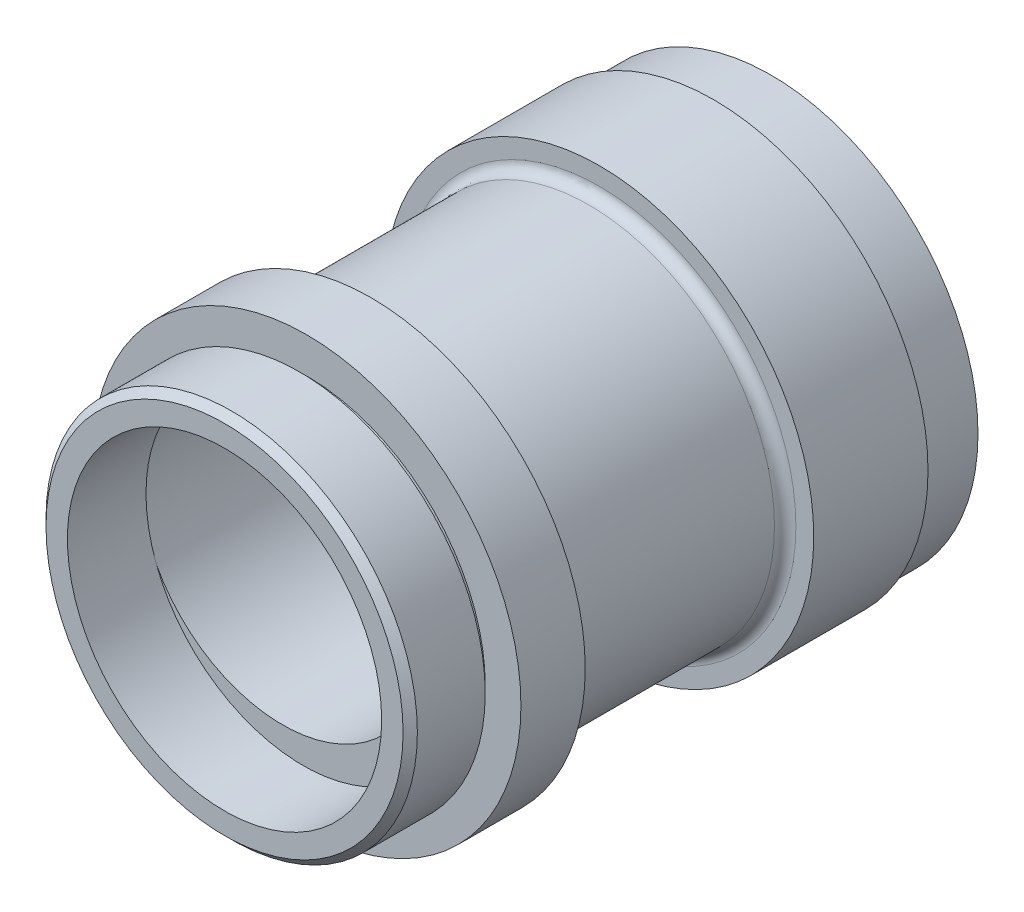
from build123d import *

# Parameters (mm, degrees)
SKETCH1_R                    = 14.5
BOSS_EXTRUDE1_DEPTH          = 4
SKETCH2_R                    = 15
BOSS_EXTRUDE2_DEPTH          = 8
SKETCH3_R                    = 13
BOSS_EXTRUDE3_DEPTH          = 16
SKETCH4_R                    = 15
BOSS_EXTRUDE4_DEPTH          = 4.5
SKETCH5_R                    = 12.5
BOSS_EXTRUDE5_DEPTH          = 0.5
SKETCH6_R                    = 13
BOSS_EXTRUDE6_DEPTH          = 5.25
SKETCH7_R                    = 11
CUT_EXTRUDE1_DEPTH           = 5.5
SKETCH8_R                    = 10
CUT_EXTRUDE2_DEPTH           = 32.75
FILLET1_R                    = 0.75
CHAMFER1_SIZE                = 0.5
F_2_0_2_DIAMETER_HOLE3_D     = 2
F_2_0_2_DIAMETER_HOLE3_DEPTH = 8.649139381
F_2_0_2_DIAMETER_HOLE3_TIP   = 0.600860619


with BuildPart() as part:
    # Sketch1 → Boss-Extrude1 (new body)
    with BuildSketch(Plane.XY):
        Circle(SKETCH1_R)
    extrude(amount=BOSS_EXTRUDE1_DEPTH)

    # Sketch2 → Boss-Extrude2 (add)
    with BuildSketch(Plane.XY.offset(4)):
        Circle(SKETCH2_R)
    extrude(amount=BOSS_EXTRUDE2_DEPTH)

    # Sketch3 → Boss-Extrude3 (add)
    with BuildSketch(Plane.XY.offset(12)):
        Circle(SKETCH3_R)
    extrude(amount=BOSS_EXTRUDE3_DEPTH)

    # Sketch4 → Boss-Extrude4 (add)
    with BuildSketch(Plane.XY.offset(28)):
        Circle(SKETCH4_R)
    extrude(amount=BOSS_EXTRUDE4_DEPTH)

    # Sketch5 → Boss-Extrude5 (add)
    with BuildSketch(Plane.XY.offset(32.5)):
        Circle(SKETCH5_R)
    extrude(amount=BOSS_EXTRUDE5_DEPTH)

    # Sketch6 → Boss-Extrude6 (add)
    with BuildSketch(Plane.XY.offset(33)):
        Circle(SKETCH6_R)
    extrude(amount=BOSS_EXTRUDE6_DEPTH)

    # Sketch7 → Cut-Extrude1 (cut)
    with BuildSketch(Plane.XY.offset(38.25)):
        Circle(SKETCH7_R)
    extrude(amount=-CUT_EXTRUDE1_DEPTH, mode=Mode.SUBTRACT)

    # Sketch8 → Cut-Extrude2 (cut)
    with BuildSketch(Plane.XY.offset(32.75)):
        with Locations((-1.44, 0.75)):
            Circle(SKETCH8_R)
    extrude(amount=-CUT_EXTRUDE2_DEPTH, mode=Mode.SUBTRACT)

    # Fillet1
    fillet1_edges = [part.edges().sort_by_distance(p)[0] for p in [
        (-13, 0, 12),
        (-13, 0, 28),
    ]]
    fillet(fillet1_edges, radius=FILLET1_R)

    # Chamfer1
    chamfer1_edges = [part.edges().sort_by_distance(p)[0] for p in [
        (-13, 0, 38.25),
    ]]
    chamfer(chamfer1_edges, length=CHAMFER1_SIZE)

    # Ø2.0 (2) Diameter Hole3
    with Locations(Plane(origin=(0, 0, 0), x_dir=(-1, 0, 0), z_dir=(0, 0, -1))):
        with Locations((-9.5, 8.9)):
            Hole(F_2_0_2_DIAMETER_HOLE3_D / 2, depth=F_2_0_2_DIAMETER_HOLE3_DEPTH)
            with Locations((0, 0, -(F_2_0_2_DIAMETER_HOLE3_DEPTH + F_2_0_2_DIAMETER_HOLE3_TIP / 2))):  # 118° drill point
                Cone(0, F_2_0_2_DIAMETER_HOLE3_D / 2, F_2_0_2_DIAMETER_HOLE3_TIP, mode=Mode.SUBTRACT)


solid = part.part
